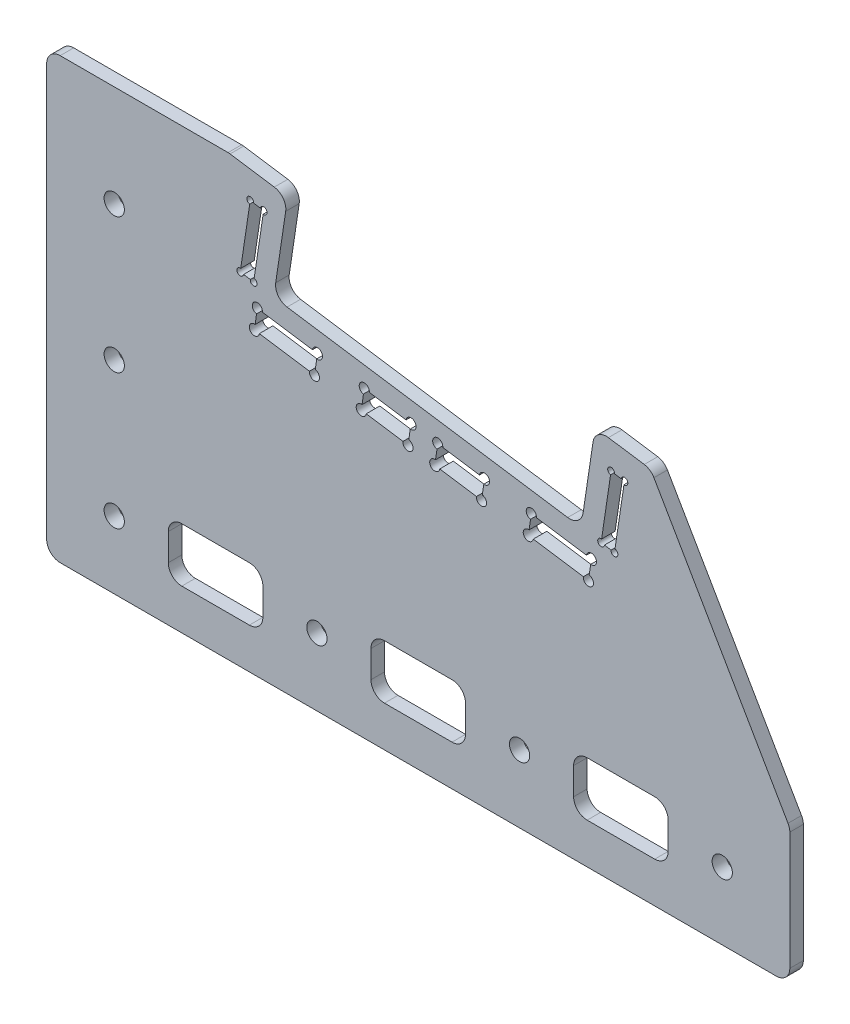
from build123d import *

# Parameters (mm, degrees)
SKETCH_1_W          = 110
SKETCH_1_H          = 65
SKETCH_1_R          = 1.5
EXTRUDE_1_DEPTH     = 2
CUT_EXTRUDE_1_DEPTH = 128.784975643
CUT_EXTRUDE_2_DEPTH = 128.784975643
CUT_EXTRUDE_3_DEPTH = 128.784975643
SKETCH_6_R          = 0.75
SKETCH_6_R_2        = 0.5
CUT_EXTRUDE_5_DEPTH = 10
CUT_EXTRUDE_6_DEPTH = 10
FILLET_1_R          = 2
CUT_EXTRUDE_7_DEPTH = 128.784975643


with BuildPart() as part:
    # 草图1 → 凸台-拉伸1 (new body)
    with BuildSketch(Plane.XY):
        with Locations((55, 32.5)):
            Rectangle(SKETCH_1_W, SKETCH_1_H)
        with Locations((10, 10)):
            Circle(SKETCH_1_R, mode=Mode.SUBTRACT)
        with Locations((10, 30)):
            Circle(SKETCH_1_R, mode=Mode.SUBTRACT)
        with Locations((10, 50)):
            Circle(SKETCH_1_R, mode=Mode.SUBTRACT)
        with Locations((40, 10)):
            Circle(SKETCH_1_R, mode=Mode.SUBTRACT)
        with Locations((70, 10)):
            Circle(SKETCH_1_R, mode=Mode.SUBTRACT)
        with Locations((100, 10)):
            Circle(SKETCH_1_R, mode=Mode.SUBTRACT)
    extrude(amount=EXTRUDE_1_DEPTH)

    # 草图2 → 切除-拉伸1 (cut, through all)
    with BuildSketch(Plane.XY.offset(2)):
        Polygon((27, 65), (110, 52.595566888), (110, 65), align=None)
    extrude(amount=-CUT_EXTRUDE_1_DEPTH, mode=Mode.SUBTRACT)

    # 草图3 → 切除-拉伸2 (cut, through all)
    with BuildSketch(Plane.XY.offset(2)):
        Polygon((35.673669122, 63.703711464), (81.168398836, 56.904478552), (79.099067081, 43.058256465), (33.604337366, 49.857489377), align=None)
    extrude(amount=-CUT_EXTRUDE_2_DEPTH, mode=Mode.SUBTRACT)

    # 草图4 → 切除-拉伸3 (cut, through all)
    with BuildSketch(Plane.XY.offset(2)):
        Polygon((32.115383887, 60.191076244), (30.637289776, 50.300917611), (28.64936789, 50.598014527), (30.127462002, 60.488173161), align=None)
        Polygon((83.544208782, 52.504986866), (82.066114671, 42.614828232), (84.044146397, 42.31920941), (85.522240509, 52.209368043), align=None)
        Polygon((31.182877406, 47.186060609), (40.084020176, 45.855775909), (39.640591943, 42.888728319), (30.739449172, 44.219013019), align=None)
        Polygon((47.00713122, 44.821110031), (53.930242263, 43.786444154), (53.48681403, 40.819396563), (46.563702986, 41.854062441), align=None)
        Polygon((57.886305717, 43.195206509), (64.80941676, 42.160540631), (64.365988527, 39.193493041), (57.442877483, 40.228158919), align=None)
        Polygon((71.732527804, 41.125874753), (80.633670574, 39.795590053), (80.19024234, 36.828542463), (71.28909957, 38.158827163), align=None)
    extrude(amount=-CUT_EXTRUDE_3_DEPTH, mode=Mode.SUBTRACT)

    # 草图6 → 切除-拉伸5 (cut)
    with BuildSketch(Plane.XY.offset(2)):
        with Locations((30.739449172, 44.219013019)):
            Circle(SKETCH_6_R)
        with Locations((31.182877406, 47.186060609)):
            Circle(SKETCH_6_R)
        with Locations((40.084020176, 45.855775909)):
            Circle(SKETCH_6_R)
        with Locations((39.640591943, 42.888728319)):
            Circle(SKETCH_6_R)
        with Locations((53.48681403, 40.819396563)):
            Circle(SKETCH_6_R)
        with Locations((46.563702986, 41.854062441)):
            Circle(SKETCH_6_R)
        with Locations((47.00713122, 44.821110031)):
            Circle(SKETCH_6_R)
        with Locations((53.930242263, 43.786444154)):
            Circle(SKETCH_6_R)
        with Locations((57.886305717, 43.195206509)):
            Circle(SKETCH_6_R)
        with Locations((57.442877483, 40.228158919)):
            Circle(SKETCH_6_R)
        with Locations((64.365988527, 39.193493041)):
            Circle(SKETCH_6_R)
        with Locations((64.80941676, 42.160540631)):
            Circle(SKETCH_6_R)
        with Locations((80.19024234, 36.828542463)):
            Circle(SKETCH_6_R)
        with Locations((80.633670574, 39.795590053)):
            Circle(SKETCH_6_R)
        with Locations((71.732527804, 41.125874753)):
            Circle(SKETCH_6_R)
        with Locations((71.28909957, 38.158827163)):
            Circle(SKETCH_6_R)
        with Locations((30.637289776, 50.300917611)):
            Circle(SKETCH_6_R_2)
        with Locations((28.64936789, 50.598014527)):
            Circle(SKETCH_6_R_2)
        with Locations((30.127462002, 60.488173161)):
            Circle(SKETCH_6_R_2)
        with Locations((32.115383887, 60.191076244)):
            Circle(SKETCH_6_R_2)
        with Locations((84.044146397, 42.31920941)):
            Circle(SKETCH_6_R_2)
        with Locations((82.066114671, 42.614828232)):
            Circle(SKETCH_6_R_2)
        with Locations((83.544208782, 52.504986866)):
            Circle(SKETCH_6_R_2)
        with Locations((85.522240509, 52.209368043)):
            Circle(SKETCH_6_R_2)
    extrude(amount=-CUT_EXTRUDE_5_DEPTH, mode=Mode.SUBTRACT)

    # 草图7 → 切除-拉伸6 (cut)
    with BuildSketch(Plane.XY.offset(2)):
        Polygon((110, 20), (89.403784355, 55.67369194), (110, 52.595566888), align=None)
    extrude(amount=-CUT_EXTRUDE_6_DEPTH, mode=Mode.SUBTRACT)

    # 圆角1
    fillet_1_edges = [part.edges().sort_by_distance(p)[0] for p in [
        (110, 0, 1),
        (27, 65, 1),
        (35.673669122, 63.703711464, 1),
        (33.604337366, 49.857489377, 1),
        (79.099067081, 43.058256465, 1),
        (81.168398836, 56.904478552, 1),
        (89.403784355, 55.67369194, 1),
        (110, 20, 1),
        (0, 65, 1),
        (0, 0, 1),
    ]]
    fillet(fillet_1_edges, radius=FILLET_1_R)

    # 草图8 → 切除-拉伸7 (cut, through all)
    with BuildSketch(Plane(origin=(0, 0, 0), x_dir=(-1, 0, 0), z_dir=(0, 0, -1))):
        with BuildLine():
            Line((-90, 14), (-80, 14))
            ThreePointArc((-80, 14), (-78.585786438, 13.414213562), (-78, 12))
            Line((-78, 12), (-78, 8))
            ThreePointArc((-78, 8), (-78.585786438, 6.585786438), (-80, 6))
            Line((-80, 6), (-90, 6))
            ThreePointArc((-90, 6), (-91.414213562, 6.585786438), (-92, 8))
            Line((-92, 8), (-92, 12))
            ThreePointArc((-92, 12), (-91.414213562, 13.414213562), (-90, 14))
        make_face()
        with BuildLine():
            Line((-62, 8), (-62, 12))
            ThreePointArc((-62, 12), (-61.414213562, 13.414213562), (-60, 14))
            Line((-60, 14), (-50, 14))
            ThreePointArc((-50, 14), (-48.585786438, 13.414213562), (-48, 12))
            Line((-48, 12), (-48, 8))
            ThreePointArc((-48, 8), (-48.585786438, 6.585786438), (-50, 6))
            Line((-50, 6), (-60, 6))
            ThreePointArc((-60, 6), (-61.414213562, 6.585786438), (-62, 8))
        make_face()
        with BuildLine():
            Line((-30, 14), (-20, 14))
            ThreePointArc((-20, 14), (-18.585786438, 13.414213562), (-18, 12))
            Line((-18, 12), (-18, 8))
            ThreePointArc((-18, 8), (-18.585786438, 6.585786438), (-20, 6))
            Line((-20, 6), (-30, 6))
            ThreePointArc((-30, 6), (-31.414213562, 6.585786438), (-32, 8))
            Line((-32, 8), (-32, 12))
            ThreePointArc((-32, 12), (-31.414213562, 13.414213562), (-30, 14))
        make_face()
    extrude(amount=-CUT_EXTRUDE_7_DEPTH, mode=Mode.SUBTRACT)


solid = part.part
